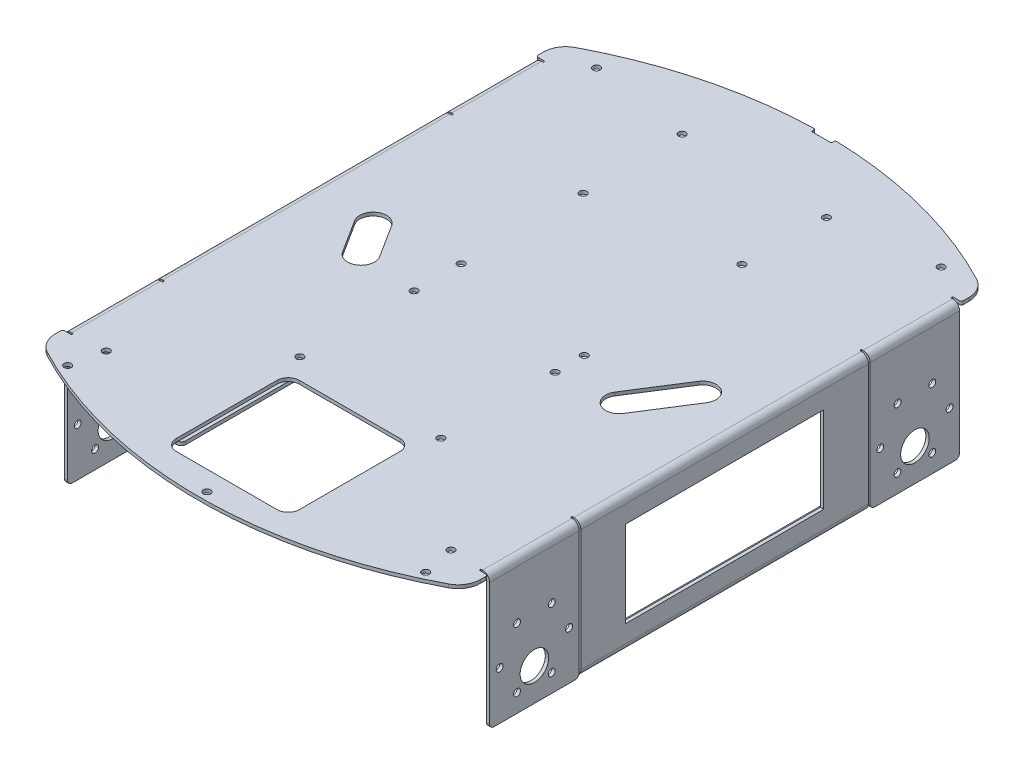
from build123d import *

# Parameters (mm, degrees)
SKETCH1_W                      = 190
SKETCH1_H                      = 230
BASE_FLANGE1_DEPTH             = 1.5
EDGE_FLANGE1_STRIP_W           = 9.3
EDGE_FLANGE1_STRIP_H           = 1.5
EDGE_FLANGE1_STRIP_CUT_DEPTH   = 40
EDGE_FLANGE1_RELIEF_W          = 10.05
EDGE_FLANGE1_RELIEF_H          = 0.75
EDGE_FLANGE1_RELIEF_CUT_DEPTH  = 1.5
EDGE_FLANGE1_DEPTH             = 40
EDGE_FLANGE2_STRIP_W           = 9.3
EDGE_FLANGE2_STRIP_H           = 1.5
EDGE_FLANGE2_STRIP_CUT_DEPTH   = 40
EDGE_FLANGE2_RELIEF_W          = 10.05
EDGE_FLANGE2_RELIEF_H          = 0.75
EDGE_FLANGE2_RELIEF_CUT_DEPTH  = 1.5
EDGE_FLANGE2_DEPTH             = 40
SKETCH18_R                     = 6.375
SKETCH18_R_2                   = 1.55
CUT_EXTRUDE1_DEPTH             = 231.185251482
FILLET1_R                      = 0.02
FILLET1_OF_MIRROR1_R           = 0.02
TAB1_DEPTH                     = 1.5
FILLET2_R                      = 10
EDGE_FLANGE3_STRIP_W           = 9.3
EDGE_FLANGE3_STRIP_H           = 1.5
EDGE_FLANGE3_STRIP_CUT_DEPTH   = 128.5
EDGE_FLANGE3_STRIP_2_W         = 9.3
EDGE_FLANGE3_STRIP_2_H         = 1.5
EDGE_FLANGE3_STRIP_CUT_2_DEPTH = 128.5
EDGE_FLANGE3_DEPTH             = 128.5
EDGE_FLANGE3_BEND_DEPTH        = 128.5
EDGE_FLANGE4_STRIP_W           = 9.3
EDGE_FLANGE4_STRIP_H           = 1.5
EDGE_FLANGE4_STRIP_CUT_DEPTH   = 128.5
EDGE_FLANGE4_STRIP_2_W         = 9.3
EDGE_FLANGE4_STRIP_2_H         = 1.5
EDGE_FLANGE4_STRIP_CUT_2_DEPTH = 128.5
EDGE_FLANGE4_DEPTH             = 128.5
EDGE_FLANGE4_BEND_DEPTH        = 128.5
FILLET3_R                      = 2
FILLET4_R                      = 1
SKETCH37_W                     = 55
SKETCH37_H                     = 55
CUT_EXTRUDE3_DEPTH             = 180.680967273
FILLET6_R                      = 5
SKETCH40_W                     = 88.5
SKETCH40_H                     = 38.5
CUT_EXTRUDE5_DEPTH             = 244.639590379
CUT_EXTRUDE9_REACH             = 181.681
SKETCH44_R                     = 1.25
SKETCH46_W                     = 40
SKETCH46_H                     = 0.5
CUT_EXTRUDE10_DEPTH            = 244.639590379
FILLET7_R                      = 2
CUT_EXTRUDE11_DEPTH            = 180.181472256
CUT_EXTRUDE12_DEPTH            = 180.680967273
FILLET8_R                      = 0.5
F_3_0MM_DOWEL_HOLE1_D          = 3.2
F_3_0MM_DOWEL_HOLE1_DEPTH      = 5
F_3_0MM_DOWEL_HOLE3_D          = 3.2
F_3_0MM_DOWEL_HOLE3_DEPTH      = 5


# Sheet-metal steps are written as plain solids
with BuildPart() as part:
    # Sketch1 → Base-Flange1 (new body)
    with BuildSketch(Plane(origin=(0, 0, 0), x_dir=(1, 0, 0), z_dir=(0, 1, 0))):
        Rectangle(SKETCH1_W, SKETCH1_H)
    extrude(amount=-BASE_FLANGE1_DEPTH)

    # Edge-Flange1 strip (across the edge) → Edge-Flange1 strip cut (cut)
    with BuildSketch(Plane(origin=(95, -1.5, 65), x_dir=(-1, 0, 0), z_dir=(0, 0, 1))):
        with Locations((-1.5, -0.75)):
            Rectangle(EDGE_FLANGE1_STRIP_W, EDGE_FLANGE1_STRIP_H)
    edge_flange1_strip_cut = extrude(amount=EDGE_FLANGE1_STRIP_CUT_DEPTH, mode=Mode.SUBTRACT)

    # Edge-Flange1 relief (on the sheet) → Edge-Flange1 relief cut (cut)
    with BuildSketch(Plane(origin=(91.85, -1.5, 65), x_dir=(-1, 0, 0), z_dir=(0, -1, 0))):
        with Locations((-4.275, 0.375)):
            Rectangle(EDGE_FLANGE1_RELIEF_W, EDGE_FLANGE1_RELIEF_H)
        with Locations((-4.275, -40.375)):
            Rectangle(EDGE_FLANGE1_RELIEF_W, EDGE_FLANGE1_RELIEF_H)
    edge_flange1_relief_cut = extrude(amount=-EDGE_FLANGE1_RELIEF_CUT_DEPTH, mode=Mode.SUBTRACT)

    # Edge-Flange1 section (across the edge) → Edge-Flange1 (add)
    with BuildSketch(Plane(origin=(95, -1.5, 65), x_dir=(-1, 0, 0), z_dir=(0, 0, 1))):
        with BuildLine():
            Line((0, 1.65), (0, 59))
            Line((0, 59), (1.5, 59))
            Line((1.5, 59), (1.5, 1.65))
            ThreePointArc((1.5, 1.65), (1.983273811, 0.483273811), (3.15, 0))
            Line((3.15, 0), (3.15, -1.5))
            ThreePointArc((3.15, -1.5), (0.922613639, -0.577386361), (0, 1.65))
        make_face()
    edge_flange1 = extrude(amount=EDGE_FLANGE1_DEPTH)

    # Edge-Flange2 strip (across the edge) → Edge-Flange2 strip cut (cut)
    with BuildSketch(Plane(origin=(95, -1.5, -105), x_dir=(-1, 0, 0), z_dir=(0, 0, 1))):
        with Locations((-1.5, -0.75)):
            Rectangle(EDGE_FLANGE2_STRIP_W, EDGE_FLANGE2_STRIP_H)
    edge_flange2_strip_cut = extrude(amount=EDGE_FLANGE2_STRIP_CUT_DEPTH, mode=Mode.SUBTRACT)

    # Edge-Flange2 relief (on the sheet) → Edge-Flange2 relief cut (cut)
    with BuildSketch(Plane(origin=(91.85, -1.5, -105), x_dir=(-1, 0, 0), z_dir=(0, -1, 0))):
        with Locations((-4.275, 0.375)):
            Rectangle(EDGE_FLANGE2_RELIEF_W, EDGE_FLANGE2_RELIEF_H)
        with Locations((-4.275, -40.375)):
            Rectangle(EDGE_FLANGE2_RELIEF_W, EDGE_FLANGE2_RELIEF_H)
    edge_flange2_relief_cut = extrude(amount=-EDGE_FLANGE2_RELIEF_CUT_DEPTH, mode=Mode.SUBTRACT)

    # Edge-Flange2 section (across the edge) → Edge-Flange2 (add)
    with BuildSketch(Plane(origin=(95, -1.5, -105), x_dir=(-1, 0, 0), z_dir=(0, 0, 1))):
        with BuildLine():
            Line((0, 1.65), (0, 59))
            Line((0, 59), (1.5, 59))
            Line((1.5, 59), (1.5, 1.65))
            ThreePointArc((1.5, 1.65), (1.983273811, 0.483273811), (3.15, 0))
            Line((3.15, 0), (3.15, -1.5))
            ThreePointArc((3.15, -1.5), (0.922613639, -0.577386361), (0, 1.65))
        make_face()
    edge_flange2 = extrude(amount=EDGE_FLANGE2_DEPTH)

    # Sketch18 → Cut-Extrude1 (cut, through all)
    with BuildSketch(Plane(origin=(95, 0, 0), x_dir=(0, 0, -1), z_dir=(1, 0, 0))):
        with Locations(Location((-85, -45.5, 0), (0, 0, 90))):
            Circle(SKETCH18_R)
        with Locations(Location((-100.5, -38.5, 0), (0, 0, 90))):
            Circle(SKETCH18_R_2)
        with Locations(Location((-92.75, -25.076606241, 0), (0, 0, 90))):
            Circle(SKETCH18_R_2)
        with Locations(Location((-77.25, -25.076606241, 0), (0, 0, 90))):
            Circle(SKETCH18_R_2)
        with Locations(Location((-69.5, -38.5, 0), (0, 0, 90))):
            Circle(SKETCH18_R_2)
        with Locations(Location((-77.25, -51.923393759, 0), (0, 0, 90))):
            Circle(SKETCH18_R_2)
        with Locations(Location((-92.75, -51.923393759, 0), (0, 0, 90))):
            Circle(SKETCH18_R_2)
        with Locations(Location((77.25, -51.923393759, 0), (0, 0, 90))):
            Circle(SKETCH18_R_2)
        with Locations(Location((92.75, -51.923393759, 0), (0, 0, 90))):
            Circle(SKETCH18_R_2)
        with Locations(Location((100.5, -38.5, 0), (0, 0, 90))):
            Circle(SKETCH18_R_2)
        with Locations(Location((69.5, -38.5, 0), (0, 0, 90))):
            Circle(SKETCH18_R_2)
        with Locations(Location((77.25, -25.076606241, 0), (0, 0, 90))):
            Circle(SKETCH18_R_2)
        with Locations(Location((85, -45.5, 0), (0, 0, 90))):
            Circle(SKETCH18_R)
        with Locations(Location((92.75, -25.076606241, 0), (0, 0, 90))):
            Circle(SKETCH18_R_2)
    cut_extrude1 = extrude(amount=-CUT_EXTRUDE1_DEPTH, mode=Mode.SUBTRACT)

    # Fillet1
    fillet1_edges = [part.edges().sort_by_distance(p)[0] for p in [
        (94.25, -60.5, -105),
        (94.25, -60.5, -65),
        (94.25, -60.5, 65),
        (94.25, -60.5, 105),
    ]]
    fillet(fillet1_edges, radius=FILLET1_R)

    # Mirror1: Edge-Flange1 strip cut, Edge-Flange1 relief cut, Edge-Flange1, Edge-Flange2 strip cut, Edge-Flange2 relief cut, Edge-Flange2, Cut-Extrude1 across plane
    add(edge_flange1_strip_cut.mirror(Plane(origin=(0, 0, 0), x_dir=(0, 0, 1), z_dir=(1, 0, 0))), mode=Mode.SUBTRACT)
    add(edge_flange1_relief_cut.mirror(Plane(origin=(0, 0, 0), x_dir=(0, 0, 1), z_dir=(1, 0, 0))), mode=Mode.SUBTRACT)
    add(edge_flange1.mirror(Plane(origin=(0, 0, 0), x_dir=(0, 0, 1), z_dir=(1, 0, 0))))
    add(edge_flange2_strip_cut.mirror(Plane(origin=(0, 0, 0), x_dir=(0, 0, 1), z_dir=(1, 0, 0))), mode=Mode.SUBTRACT)
    add(edge_flange2_relief_cut.mirror(Plane(origin=(0, 0, 0), x_dir=(0, 0, 1), z_dir=(1, 0, 0))), mode=Mode.SUBTRACT)
    add(edge_flange2.mirror(Plane(origin=(0, 0, 0), x_dir=(0, 0, 1), z_dir=(1, 0, 0))))
    add(cut_extrude1.mirror(Plane(origin=(0, 0, 0), x_dir=(0, 0, 1), z_dir=(1, 0, 0))), mode=Mode.SUBTRACT)

    # Fillet1 of Mirror1
    fillet1_of_mirror1_edges = [part.edges().sort_by_distance(p)[0] for p in [
        (-94.25, -60.5, -105),
        (-94.25, -60.5, -65),
        (-94.25, -60.5, 65),
        (-94.25, -60.5, 105),
    ]]
    fillet(fillet1_of_mirror1_edges, radius=FILLET1_OF_MIRROR1_R)

    # Sketch20 → Tab1 (add)
    with BuildSketch(Plane(origin=(0, 0, 0), x_dir=(1, 0, 0), z_dir=(0, 1, 0))):
        with BuildLine():
            Line((-95, -115), (95, -115))
            ThreePointArc((95, -115), (0, -140), (-95, -115))
        make_face()
        with BuildLine():
            Line((-95, 115), (95, 115))
            ThreePointArc((95, 115), (0, 140), (-95, 115))
        make_face()
    extrude(amount=-TAB1_DEPTH)

    # Fillet2
    fillet2_edges = [part.edges().sort_by_distance(p)[0] for p in [
        (-95, -0.75, -115),
        (95, -0.75, -115),
        (95, -0.75, 115),
        (-95, -0.75, 115),
    ]]
    fillet(fillet2_edges, radius=FILLET2_R)

    # Edge-Flange3 strip (across the edge) → Edge-Flange3 strip cut (cut)
    with BuildSketch(Plane(origin=(95, -1.5, -64.25), x_dir=(-1, 0, 0), z_dir=(0, 0, 1))):
        with Locations((-1.5, -0.75)):
            Rectangle(EDGE_FLANGE3_STRIP_W, EDGE_FLANGE3_STRIP_H)
    extrude(amount=EDGE_FLANGE3_STRIP_CUT_DEPTH, mode=Mode.SUBTRACT)

    # Edge-Flange3 strip 2 (across the edge) → Edge-Flange3 strip cut 2 (cut)
    with BuildSketch(Plane(origin=(-95, -1.5, 64.25), x_dir=(1, 0, 0), z_dir=(0, 0, -1))):
        with Locations((-1.5, -0.75)):
            Rectangle(EDGE_FLANGE3_STRIP_2_W, EDGE_FLANGE3_STRIP_2_H)
    extrude(amount=EDGE_FLANGE3_STRIP_CUT_2_DEPTH, mode=Mode.SUBTRACT)

    # Edge-Flange3 section (across the edge) → Edge-Flange3 (add)
    with BuildSketch(Plane(origin=(95, -1.5, -64.25), x_dir=(-1, 0, 0), z_dir=(0, 0, 1))):
        with BuildLine():
            Line((0, 1.65), (0, 59))
            Line((0, 59), (1.5, 59))
            Line((1.5, 59), (1.5, 1.65))
            ThreePointArc((1.5, 1.65), (1.983273811, 0.483273811), (3.15, 0))
            Line((3.15, 0), (3.15, -1.5))
            ThreePointArc((3.15, -1.5), (0.922613639, -0.577386361), (0, 1.65))
        make_face()
    extrude(amount=EDGE_FLANGE3_DEPTH)

    # Edge-Flange3 section 2 (across the edge) → Edge-Flange3 bend (add)
    with BuildSketch(Plane(origin=(-95, -1.5, 64.25), x_dir=(1, 0, 0), z_dir=(0, 0, -1))):
        with BuildLine():
            Line((0, 1.65), (0, 59))
            Line((0, 59), (1.5, 59))
            Line((1.5, 59), (1.5, 1.65))
            ThreePointArc((1.5, 1.65), (1.983273811, 0.483273811), (3.15, 0))
            Line((3.15, 0), (3.15, -1.5))
            ThreePointArc((3.15, -1.5), (0.922613639, -0.577386361), (0, 1.65))
        make_face()
    extrude(amount=EDGE_FLANGE3_BEND_DEPTH)

    # Edge-Flange4 strip (across the edge) → Edge-Flange4 strip cut (cut)
    with BuildSketch(Plane(origin=(-93.5, -60.5, 64.25), x_dir=(0, 1, 0), z_dir=(0, 0, -1))):
        with Locations((-1.5, -0.75)):
            Rectangle(EDGE_FLANGE4_STRIP_W, EDGE_FLANGE4_STRIP_H)
    extrude(amount=EDGE_FLANGE4_STRIP_CUT_DEPTH, mode=Mode.SUBTRACT)

    # Edge-Flange4 strip 2 (across the edge) → Edge-Flange4 strip cut 2 (cut)
    with BuildSketch(Plane(origin=(93.5, -60.5, -64.25), x_dir=(0, 1, 0), z_dir=(0, 0, 1))):
        with Locations((-1.5, -0.75)):
            Rectangle(EDGE_FLANGE4_STRIP_2_W, EDGE_FLANGE4_STRIP_2_H)
    extrude(amount=EDGE_FLANGE4_STRIP_CUT_2_DEPTH, mode=Mode.SUBTRACT)

    # Edge-Flange4 section (across the edge) → Edge-Flange4 (add)
    with BuildSketch(Plane(origin=(-93.5, -60.5, 64.25), x_dir=(0, 1, 0), z_dir=(0, 0, -1))):
        with BuildLine():
            Line((0, 1.65), (0, 10))
            Line((0, 10), (1.5, 10))
            Line((1.5, 10), (1.5, 1.65))
            ThreePointArc((1.5, 1.65), (1.983273811, 0.483273811), (3.15, 0))
            Line((3.15, 0), (3.15, -1.5))
            ThreePointArc((3.15, -1.5), (0.922613639, -0.577386361), (0, 1.65))
        make_face()
    extrude(amount=EDGE_FLANGE4_DEPTH)

    # Edge-Flange4 section 2 (across the edge) → Edge-Flange4 bend (add)
    with BuildSketch(Plane(origin=(93.5, -60.5, -64.25), x_dir=(0, 1, 0), z_dir=(0, 0, 1))):
        with BuildLine():
            Line((0, 1.65), (0, 10))
            Line((0, 10), (1.5, 10))
            Line((1.5, 10), (1.5, 1.65))
            ThreePointArc((1.5, 1.65), (1.983273811, 0.483273811), (3.15, 0))
            Line((3.15, 0), (3.15, -1.5))
            ThreePointArc((3.15, -1.5), (0.922613639, -0.577386361), (0, 1.65))
        make_face()
    extrude(amount=EDGE_FLANGE4_BEND_DEPTH)

    # Fillet3
    fillet3_edges = [part.edges().sort_by_distance(p)[0] for p in [
        (-83.5, -59.75, 64.25),
        (-83.5, -59.75, -64.25),
        (83.5, -59.75, -64.25),
        (83.5, -59.75, 64.25),
    ]]
    fillet(fillet3_edges, radius=FILLET3_R)

    # Fillet4
    fillet4_edges = [part.edges().sort_by_distance(p)[0] for p in [
        (95, -0.75, 105.75),
        (-95, -0.75, 105.75),
        (-95, -0.75, -105.75),
        (95, -0.75, -105.75),
    ]]
    fillet(fillet4_edges, radius=FILLET4_R)

    # Sketch37 → Cut-Extrude3 (cut, through all)
    with BuildSketch(Plane(origin=(0, 0, 0), x_dir=(1, 0, 0), z_dir=(0, 1, 0))):
        with Locations((0, -100)):
            Rectangle(SKETCH37_W, SKETCH37_H)
    extrude(amount=-CUT_EXTRUDE3_DEPTH, mode=Mode.SUBTRACT)

    # Fillet6
    fillet6_edges = [part.edges().sort_by_distance(p)[0] for p in [
        (27.5, -0.75, 72.5),
        (27.5, -0.75, 127.5),
        (-27.5, -0.75, 127.5),
        (-27.5, -0.75, 72.5),
    ]]
    fillet(fillet6_edges, radius=FILLET6_R)

    # Sketch40 → Cut-Extrude5 (cut, through all)
    with BuildSketch(Plane(origin=(95, 0, 0), x_dir=(0, 0, -1), z_dir=(1, 0, 0))):
        with Locations((0, -30.25)):
            Rectangle(SKETCH40_W, SKETCH40_H)
    extrude(amount=-CUT_EXTRUDE5_DEPTH, mode=Mode.SUBTRACT)

    # Sketch44 → Cut-Extrude9 (cut, up to next)
    with BuildSketch(Plane.XZ.offset(60.5), mode=Mode.PRIVATE) as cut_extrude9_sk1:
        with Locations((-87.5, 0)):
            Circle(SKETCH44_R)
    cut_extrude9_tool1 = extrude(cut_extrude9_sk1.sketch, amount=-CUT_EXTRUDE9_REACH, mode=Mode.PRIVATE) & part.part
    # Sketch44 → Cut-Extrude9 (cut, up to next)
    with BuildSketch(Plane.XZ.offset(60.5), mode=Mode.PRIVATE) as cut_extrude9_sk2:
        with Locations((87.5, 0)):
            Circle(SKETCH44_R)
    cut_extrude9_tool2 = extrude(cut_extrude9_sk2.sketch, amount=-CUT_EXTRUDE9_REACH, mode=Mode.PRIVATE) & part.part
    add(cut_extrude9_tool1.solids().sort_by_distance((-87.5, -60.5, 0))[0], mode=Mode.SUBTRACT)
    add(cut_extrude9_tool2.solids().sort_by_distance((87.5, -60.5, 0))[0], mode=Mode.SUBTRACT)

    # Sketch46 → Cut-Extrude10 (cut, through all)
    with BuildSketch(Plane.ZY.offset(95)):
        with Locations((-85, -60.25)):
            Rectangle(SKETCH46_W, SKETCH46_H)
        with Locations((85, -60.25)):
            Rectangle(SKETCH46_W, SKETCH46_H)
    extrude(amount=-CUT_EXTRUDE10_DEPTH, mode=Mode.SUBTRACT)

    # Fillet7
    fillet7_edges = [part.edges().sort_by_distance(p)[0] for p in [
        (94.25, -60, -105),
        (94.25, -60, -65),
        (-94.25, -60, -105),
        (-94.25, -60, -65),
        (94.25, -60, 65),
        (-94.25, -60, 65),
        (94.25, -60, 105),
        (-94.25, -60, 105),
    ]]
    fillet(fillet7_edges, radius=FILLET7_R)

    # Sketch47 → Cut-Extrude11 (cut, through all)
    with BuildSketch(Plane(origin=(0, -1.5, 0), x_dir=(-1, 0, 0), z_dir=(0, -1, 0))):
        with BuildLine():
            Line((-67.002736372, 16.27706675), (-52.535412907, -6.519787239))
            ThreePointArc((-52.535412907, -6.519787239), (-54.38641969, -14.800715562), (-62.667348013, -12.949708778))
            Line((-62.667348013, -12.949708778), (-77.134671478, 9.84714521))
            ThreePointArc((-77.134671478, 9.84714521), (-75.283664695, 18.128073533), (-67.002736372, 16.27706675))
        make_face()
        with BuildLine():
            Line((71.910360227, 1.614947937), (62.533391315, -13.16079076))
            ThreePointArc((62.533391315, -13.16079076), (54.252462992, -15.011797543), (52.401456208, -6.73086922))
            Line((52.401456208, -6.73086922), (61.778425121, 8.044869476))
            ThreePointArc((61.778425121, 8.044869476), (70.059353444, 9.895876259), (71.910360227, 1.614947937))
        make_face()
    extrude(amount=-CUT_EXTRUDE11_DEPTH, mode=Mode.SUBTRACT)

    # Sketch48 → Cut-Extrude12 (cut, through all)
    with BuildSketch(Plane(origin=(0, 0, 0), x_dir=(1, 0, 0), z_dir=(0, 1, 0))):
        with BuildLine():
            Line((-4.5, 139.947531728), (-4.5, 138.197531728))
            Line((-4.5, 138.197531728), (4.5, 138.197531728))
            Line((4.5, 138.197531728), (4.5, 139.947531728))
            ThreePointArc((4.5, 139.947531728), (0, 140), (-4.5, 139.947531728))
        make_face()
    extrude(amount=-CUT_EXTRUDE12_DEPTH, mode=Mode.SUBTRACT)

    # Fillet8
    fillet8_edges = [part.edges().sort_by_distance(p)[0] for p in [
        (-4.5, -0.75, -139.947531728),
        (4.5, -0.75, -139.947531728),
        (4.5, -0.75, -138.197531728),
        (-4.5, -0.75, -138.197531728),
    ]]
    fillet(fillet8_edges, radius=FILLET8_R)

    # Ø3.0mm Dowel Hole1
    with Locations(Plane(origin=(0, 0, 0), x_dir=(1, 0, 0), z_dir=(0, 1, 0))):
        with Locations((-77, 114.721156261), (77, 114.721156261), (-77, -104.278843739), (77, -104.278843739)):
            Hole(F_3_0MM_DOWEL_HOLE1_D / 2, depth=F_3_0MM_DOWEL_HOLE1_DEPTH)

    # Ø3.0mm Dowel Hole3
    with Locations(Plane(origin=(0, -1.5, 0), x_dir=(-1, 0, 0), z_dir=(0, -1, 0))):
        with Locations((31.5, -63.25), (-31.5, -63.25), (31.5, -12.25), (-31.5, -12.25), (31.5, 8.75), (-31.5, 0.8), (31.5, 63.25), (-31.5, 71.2), (-79.980506034, -118.518748697), (79.980506034, -118.518748697), (0, -136.25), (-32.25, 108.25), (32.25, 108.25)):
            Hole(F_3_0MM_DOWEL_HOLE3_D / 2, depth=F_3_0MM_DOWEL_HOLE3_DEPTH)


solid = part.part
